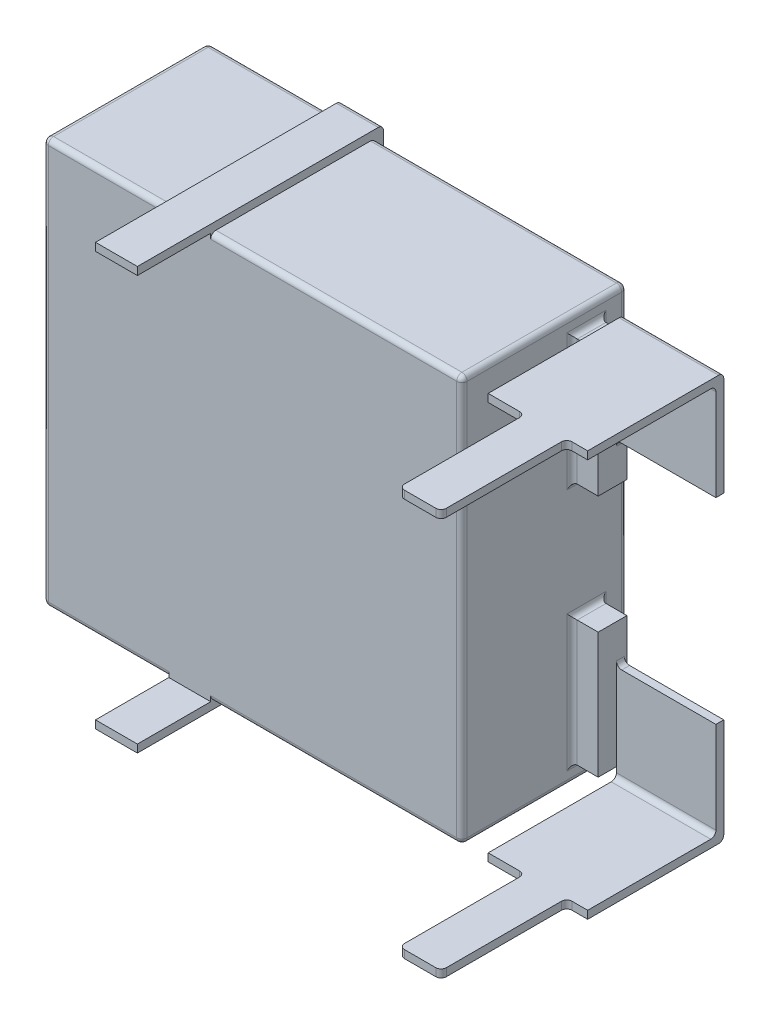
from build123d import *

# Parameters (mm, degrees)
SKETCH1_W           = 16
SKETCH1_H           = 15.5
BOSS_EXTRUDE1_DEPTH = 3.15
SKETCH2_W           = 4.839568974
SKETCH2_H           = 7
CUT_EXTRUDE1_DEPTH  = 10
SKETCH4_W           = 1.09636118
SKETCH4_H           = 4.8
BOSS_EXTRUDE3_DEPTH = 1
FILLET2_R           = 0.2
SKETCH5_W           = 0.3
SKETCH5_H           = 4
BOSS_EXTRUDE4_DEPTH = 3.8
SKETCH6_W           = 3.8
SKETCH6_H           = 0.3
BOSS_EXTRUDE5_DEPTH = 4.9
SKETCH7_W           = 1.6
SKETCH7_H           = 0.3
BOSS_EXTRUDE6_DEPTH = 4.8
FILLET3_R           = 0.2
SKETCH8_W           = 1.6
SKETCH8_H           = 16.1
BOSS_EXTRUDE7_DEPTH = 0.3
SKETCH9_W           = 1.6
SKETCH9_H           = 0.3
BOSS_EXTRUDE8_DEPTH = 9.1
FILLET5_R           = 0.2


with BuildPart() as part:
    # Sketch1 → Boss-Extrude1 (new, symmetric)
    with BuildSketch(Plane.XY):
        with Locations((-9.153020979, 0.149054717)):
            Rectangle(SKETCH1_W, SKETCH1_H)
    extrude(amount=BOSS_EXTRUDE1_DEPTH, both=True)

    # Sketch2 → Cut-Extrude1 (cut)
    with BuildSketch(Plane.ZY.offset(17.153020979)):
        with Locations((0, 4.099054717)):
            Rectangle(SKETCH2_W, SKETCH2_H)
        with Locations((0, -3.800945283)):
            Rectangle(SKETCH2_W, SKETCH2_H)
    extrude(amount=-CUT_EXTRUDE1_DEPTH, mode=Mode.SUBTRACT)

    # Sketch4 → Boss-Extrude3 (add)
    with BuildSketch(Plane(origin=(-1.153020979, 0, 0), x_dir=(0, 0, -1), z_dir=(1, 0, 0))):
        with Locations((1.60181941, 4.799054717)):
            Rectangle(SKETCH4_W, SKETCH4_H)
        with Locations((1.60181941, -4.500945283)):
            Rectangle(SKETCH4_W, SKETCH4_H)
    extrude(amount=BOSS_EXTRUDE3_DEPTH)

    # Fillet2
    fillet2_edges = [part.edges().sort_by_distance(p)[0] for p in [
        (-1.153020979, -2.100945283, -1.60181941),
        (-1.153020979, -4.500945283, -1.05363882),
        (-1.153020979, -6.900945283, -1.60181941),
        (-1.153020979, -4.500945283, -2.15),
        (-1.153020979, 7.199054717, -1.60181941),
        (-1.153020979, 4.799054717, -1.05363882),
        (-1.153020979, 2.399054717, -1.60181941),
        (-1.153020979, 4.799054717, -2.15),
    ]]
    fillet(fillet2_edges, radius=FILLET2_R)

    # Sketch5 → Boss-Extrude4 (add)
    with BuildSketch(Plane(origin=(-0.153020979, 0, 0), x_dir=(0, 0, -1), z_dir=(1, 0, 0))):
        with Locations((1.901438406, 5.899054717)):
            Rectangle(SKETCH5_W, SKETCH5_H)
        with Locations((1.901438406, -5.600945283)):
            Rectangle(SKETCH5_W, SKETCH5_H)
    extrude(amount=BOSS_EXTRUDE4_DEPTH)

    # Sketch6 → Boss-Extrude5 (add)
    with BuildSketch(Plane.XY.offset(-1.751438406)):
        with Locations((1.746979021, -7.450945283)):
            Rectangle(SKETCH6_W, SKETCH6_H)
        with Locations((1.746979021, 7.749054717)):
            Rectangle(SKETCH6_W, SKETCH6_H)
    extrude(amount=BOSS_EXTRUDE5_DEPTH)

    # Sketch7 → Boss-Extrude6 (add)
    with BuildSketch(Plane.XY.offset(3.148561594)):
        with Locations((2.046979021, 7.749054717)):
            Rectangle(SKETCH7_W, SKETCH7_H)
        with Locations((2.046979021, -7.450945283)):
            Rectangle(SKETCH7_W, SKETCH7_H)
    extrude(amount=BOSS_EXTRUDE6_DEPTH)

    # Fillet3
    fillet3_edges = [part.edges().sort_by_distance(p)[0] for p in [
        (-0.153020979, 3.899054717, -1.901438406),
        (1.746979021, 7.899054717, -2.051438406),
        (1.746979021, -7.300945283, -1.751438406),
        (1.746979021, 7.599054717, -1.751438406),
        (1.246979021, 7.749054717, 3.148561594),
        (2.846979021, 7.749054717, 3.148561594),
        (1.246979021, 7.749054717, 7.948561594),
        (2.846979021, 7.749054717, 7.948561594),
        (1.246979021, -7.450945283, 3.148561594),
        (2.846979021, -7.450945283, 3.148561594),
        (1.246979021, -7.450945283, 7.948561594),
        (2.846979021, -7.450945283, 7.948561594),
        (1.746979021, -7.600945283, -2.051438406),
        (-0.153020979, -3.600945283, -1.901438406),
    ]]
    fillet(fillet3_edges, radius=FILLET3_R)

    # Sketch8 → Boss-Extrude7 (add)
    with BuildSketch(Plane(origin=(0, 0, -3.15), x_dir=(-1, 0, 0), z_dir=(0, 0, -1))):
        with Locations((11.553020979, 0.149054717)):
            Rectangle(SKETCH8_W, SKETCH8_H)
    extrude(amount=BOSS_EXTRUDE7_DEPTH)

    # Sketch9 → Boss-Extrude8 (add)
    with BuildSketch(Plane.XY.offset(-3.15)):
        with Locations((-11.553020979, -7.750945283)):
            Rectangle(SKETCH9_W, SKETCH9_H)
        with Locations((-11.553020979, 8.049054717)):
            Rectangle(SKETCH9_W, SKETCH9_H)
    extrude(amount=BOSS_EXTRUDE8_DEPTH)

    # Fillet5
    # the kernel refuses this fillet: 0.2 mm, written as the material it takes off along each edge
    with BuildSketch(Plane(origin=(-16.953020979, 7.699054717, 2.95), x_dir=(0, 0, 1), z_dir=(0, 1, 0))) as fillet5_piece_1_section:
        Polygon((0, 0), (FILLET5_R * 1.02, 0), (FILLET5_R * 1.02, -FILLET5_R * 1.02), (0, -FILLET5_R * 1.02), align=None)
    fillet5_piece_1 = extrude(amount=FILLET5_R * 1.02, mode=Mode.PRIVATE)
    fillet5_piece_1 = fillet5_piece_1 - Plane(origin=(-16.953020979, 7.699054717, 2.95), x_dir=(0.7071067811865475, 0, -0.7071067811865475), z_dir=(0, 1, 0)) * Sphere(FILLET5_R, mode=Mode.PRIVATE)
    add(fillet5_piece_1, mode=Mode.SUBTRACT)
    with BuildSketch(Plane(origin=(-16.953020979, -7.400945283, 2.95), x_dir=(-1, 0, 0), z_dir=(0, 0, 1))) as fillet5_piece_2_section:
        Polygon((0, 0), (FILLET5_R * 1.02, 0), (FILLET5_R * 1.02, FILLET5_R * 1.02), (0, FILLET5_R * 1.02), align=None)
    fillet5_piece_2 = extrude(amount=FILLET5_R * 1.02, mode=Mode.PRIVATE)
    fillet5_piece_2 = fillet5_piece_2 - Plane(origin=(-16.953020979, -7.400945283, 2.95), x_dir=(0.7071067811865475, 0.7071067811865477, 0), z_dir=(0, 0, 1)) * Sphere(FILLET5_R, mode=Mode.PRIVATE)
    add(fillet5_piece_2, mode=Mode.SUBTRACT)
    with BuildSketch(Plane(origin=(-1.353020979, -7.400945283, -2.95), x_dir=(0, 0, -1), z_dir=(0, -1, 0))) as fillet5_piece_3_section:
        Polygon((0, 0), (FILLET5_R * 1.02, 0), (FILLET5_R * 1.02, FILLET5_R * 1.02), (0, FILLET5_R * 1.02), align=None)
    fillet5_piece_3 = extrude(amount=FILLET5_R * 1.02, mode=Mode.PRIVATE)
    fillet5_piece_3 = fillet5_piece_3 - Plane(origin=(-1.353020979, -7.400945283, -2.95), x_dir=(-0.7071067811865475, 0, 0.7071067811865475), z_dir=(0, -1, 0)) * Sphere(FILLET5_R, mode=Mode.PRIVATE)
    add(fillet5_piece_3, mode=Mode.SUBTRACT)
    with BuildSketch(Plane(origin=(-1.353020979, 7.699054717, -2.95), x_dir=(0, 0, -1), z_dir=(0, 1, 0))) as fillet5_piece_4_section:
        Polygon((0, 0), (FILLET5_R * 1.02, 0), (FILLET5_R * 1.02, -FILLET5_R * 1.02), (0, -FILLET5_R * 1.02), align=None)
    fillet5_piece_4 = extrude(amount=FILLET5_R * 1.02, mode=Mode.PRIVATE)
    fillet5_piece_4 = fillet5_piece_4 - Plane(origin=(-1.353020979, 7.699054717, -2.95), x_dir=(-0.7071067811865475, 0, 0.7071067811865475), z_dir=(0, 1, 0)) * Sphere(FILLET5_R, mode=Mode.PRIVATE)
    add(fillet5_piece_4, mode=Mode.SUBTRACT)
    with BuildSketch(Plane(origin=(-1.353020979, -7.400945283, 2.95), x_dir=(0, -1, 0), z_dir=(0, 0, 1))) as fillet5_piece_5_section:
        Polygon((0, 0), (FILLET5_R * 1.02, 0), (FILLET5_R * 1.02, FILLET5_R * 1.02), (0, FILLET5_R * 1.02), align=None)
    fillet5_piece_5 = extrude(amount=FILLET5_R * 1.02, mode=Mode.PRIVATE)
    fillet5_piece_5 = fillet5_piece_5 - Plane(origin=(-1.353020979, -7.400945283, 2.95), x_dir=(-0.7071067811865476, 0.7071067811865475, 0), z_dir=(0, 0, 1)) * Sphere(FILLET5_R, mode=Mode.PRIVATE)
    add(fillet5_piece_5, mode=Mode.SUBTRACT)
    with BuildSketch(Plane(origin=(-1.353020979, 7.699054717, 2.95), x_dir=(0, 1, 0), z_dir=(0, 0, 1))) as fillet5_piece_6_section:
        Polygon((0, 0), (FILLET5_R * 1.02, 0), (FILLET5_R * 1.02, -FILLET5_R * 1.02), (0, -FILLET5_R * 1.02), align=None)
    fillet5_piece_6 = extrude(amount=FILLET5_R * 1.02, mode=Mode.PRIVATE)
    fillet5_piece_6 = fillet5_piece_6 - Plane(origin=(-1.353020979, 7.699054717, 2.95), x_dir=(-0.7071067811865475, -0.7071067811865477, 0), z_dir=(0, 0, 1)) * Sphere(FILLET5_R, mode=Mode.PRIVATE)
    add(fillet5_piece_6, mode=Mode.SUBTRACT)
    with BuildSketch(Plane(origin=(-16.953020979, -7.400945283, -2.95), x_dir=(-1, 0, 0), z_dir=(0, -1, 0))) as fillet5_piece_7_section:
        Polygon((0, 0), (FILLET5_R * 1.02, 0), (FILLET5_R * 1.02, FILLET5_R * 1.02), (0, FILLET5_R * 1.02), align=None)
    fillet5_piece_7 = extrude(amount=FILLET5_R * 1.02, mode=Mode.PRIVATE)
    fillet5_piece_7 = fillet5_piece_7 - Plane(origin=(-16.953020979, -7.400945283, -2.95), x_dir=(0.7071067811865475, 0, 0.7071067811865475), z_dir=(0, -1, 0)) * Sphere(FILLET5_R, mode=Mode.PRIVATE)
    add(fillet5_piece_7, mode=Mode.SUBTRACT)
    with BuildSketch(Plane(origin=(-16.953020979, 7.699054717, -2.95), x_dir=(-1, 0, 0), z_dir=(0, 1, 0))) as fillet5_piece_8_section:
        Polygon((0, 0), (FILLET5_R * 1.02, 0), (FILLET5_R * 1.02, -FILLET5_R * 1.02), (0, -FILLET5_R * 1.02), align=None)
    fillet5_piece_8 = extrude(amount=FILLET5_R * 1.02, mode=Mode.PRIVATE)
    fillet5_piece_8 = fillet5_piece_8 - Plane(origin=(-16.953020979, 7.699054717, -2.95), x_dir=(0.7071067811865475, 0, 0.7071067811865475), z_dir=(0, 1, 0)) * Sphere(FILLET5_R, mode=Mode.PRIVATE)
    add(fillet5_piece_8, mode=Mode.SUBTRACT)
    with BuildSketch(Plane(origin=(-16.953020979, 7.899054717, 3.15), x_dir=(0, -1, 0), z_dir=(1, 0, 0))) as fillet5_piece_9_section:
        with BuildLine():
            CenterArc((FILLET5_R, FILLET5_R), FILLET5_R, 180, 90)
            Line((0, FILLET5_R), (-FILLET5_R * 0.02, FILLET5_R))
            Line((-FILLET5_R * 0.02, FILLET5_R), (-FILLET5_R * 0.02, -FILLET5_R * 0.02))
            Line((-FILLET5_R * 0.02, -FILLET5_R * 0.02), (FILLET5_R, -FILLET5_R * 0.02))
            Line((FILLET5_R, -FILLET5_R * 0.02), (FILLET5_R, 0))
        make_face()
    fillet5_piece_9 = extrude(amount=4.6, mode=Mode.PRIVATE)
    fillet5_piece_9 = split(fillet5_piece_9, bisect_by=Plane(origin=(-14.653020979, 7.899054717, 3.109305374), z_dir=(0, -1, 0)), keep=Keep.TOP, mode=Mode.PRIVATE)
    add(fillet5_piece_9, mode=Mode.SUBTRACT)
    with BuildSketch(Plane(origin=(-17.153020979, -7.400945283, 3.15), x_dir=(1, 0, 0), z_dir=(0, 1, 0)), Plane(origin=(-17.153020979, -7.400945283, -3.15), x_dir=(0, 0, 1), z_dir=(0, 1, 0)), Plane(origin=(-1.153020979, 7.699054717, -3.15), x_dir=(0, 0, 1), z_dir=(0, -1, 0))) as fillet5_piece_10:
        with BuildLine():
            CenterArc((FILLET5_R, FILLET5_R), FILLET5_R, 180, 90)
            Line((0, FILLET5_R), (-FILLET5_R * 0.02, FILLET5_R))
            Line((-FILLET5_R * 0.02, FILLET5_R), (-FILLET5_R * 0.02, -FILLET5_R * 0.02))
            Line((-FILLET5_R * 0.02, -FILLET5_R * 0.02), (FILLET5_R, -FILLET5_R * 0.02))
            Line((FILLET5_R, -FILLET5_R * 0.02), (FILLET5_R, 0))
        make_face()
    extrude(amount=15.1, mode=Mode.SUBTRACT)
    with BuildSketch(Plane(origin=(-17.153020979, 0.599054717, 2.419784487), x_dir=(0, 0, 1), z_dir=(0, 1, 0)), Plane(origin=(-17.153020979, 7.599054717, -2.419784487), x_dir=(0, 0, -1), z_dir=(0, -1, 0))) as fillet5_piece_11:
        with BuildLine():
            CenterArc((FILLET5_R, FILLET5_R), FILLET5_R, 180, 90)
            Line((0, FILLET5_R), (-FILLET5_R * 0.02, FILLET5_R))
            Line((-FILLET5_R * 0.02, FILLET5_R), (-FILLET5_R * 0.02, -FILLET5_R * 0.02))
            Line((-FILLET5_R * 0.02, -FILLET5_R * 0.02), (FILLET5_R, -FILLET5_R * 0.02))
            Line((FILLET5_R, -FILLET5_R * 0.02), (FILLET5_R, 0))
        make_face()
    extrude(amount=7, mode=Mode.SUBTRACT)
    with BuildSketch(Plane(origin=(-17.153020979, 7.599054717, 2.419784487), x_dir=(0, 1, 0), z_dir=(0, 0, -1)), Plane(origin=(-17.153020979, 0.599054717, -2.419784487), x_dir=(0, -1, 0), z_dir=(0, 0, 1))) as fillet5_piece_12:
        with BuildLine():
            CenterArc((FILLET5_R, FILLET5_R), FILLET5_R, 180, 90)
            Line((0, FILLET5_R), (-FILLET5_R * 0.02, FILLET5_R))
            Line((-FILLET5_R * 0.02, FILLET5_R), (-FILLET5_R * 0.02, -FILLET5_R * 0.02))
            Line((-FILLET5_R * 0.02, -FILLET5_R * 0.02), (FILLET5_R, -FILLET5_R * 0.02))
            Line((FILLET5_R, -FILLET5_R * 0.02), (FILLET5_R, 0))
        make_face()
    extrude(amount=4.839568974, mode=Mode.SUBTRACT)
    with BuildSketch(Plane(origin=(-17.153020979, -7.300945283, -2.419784487), x_dir=(0, 0, -1), z_dir=(0, 1, 0)), Plane(origin=(-17.153020979, -0.300945283, 2.419784487), x_dir=(0, 0, 1), z_dir=(0, -1, 0))) as fillet5_piece_13:
        with BuildLine():
            CenterArc((FILLET5_R, -FILLET5_R), FILLET5_R, 90, 90)
            Line((0, -FILLET5_R), (-FILLET5_R * 0.02, -FILLET5_R))
            Line((-FILLET5_R * 0.02, -FILLET5_R), (-FILLET5_R * 0.02, FILLET5_R * 0.02))
            Line((-FILLET5_R * 0.02, FILLET5_R * 0.02), (FILLET5_R, FILLET5_R * 0.02))
            Line((FILLET5_R, FILLET5_R * 0.02), (FILLET5_R, 0))
        make_face()
    extrude(amount=7, mode=Mode.SUBTRACT)
    with BuildSketch(Plane(origin=(-17.153020979, -7.300945283, 2.419784487), x_dir=(0, -1, 0), z_dir=(0, 0, -1)), Plane(origin=(-17.153020979, -0.300945283, -2.419784487), x_dir=(0, 1, 0), z_dir=(0, 0, 1))) as fillet5_piece_14:
        with BuildLine():
            CenterArc((FILLET5_R, -FILLET5_R), FILLET5_R, 90, 90)
            Line((0, -FILLET5_R), (-FILLET5_R * 0.02, -FILLET5_R))
            Line((-FILLET5_R * 0.02, -FILLET5_R), (-FILLET5_R * 0.02, FILLET5_R * 0.02))
            Line((-FILLET5_R * 0.02, FILLET5_R * 0.02), (FILLET5_R, FILLET5_R * 0.02))
            Line((FILLET5_R, FILLET5_R * 0.02), (FILLET5_R, 0))
        make_face()
    extrude(amount=4.839568974, mode=Mode.SUBTRACT)
    with BuildSketch(Plane(origin=(-1.353020979, -7.600945283, -3.15), x_dir=(0, 0, 1), z_dir=(-1, 0, 0)), Plane(origin=(-10.753020979, 7.899054717, -3.15), x_dir=(0, 0, 1), z_dir=(1, 0, 0))) as fillet5_piece_15:
        with BuildLine():
            CenterArc((FILLET5_R, FILLET5_R), FILLET5_R, 180, 90)
            Line((0, FILLET5_R), (-FILLET5_R * 0.02, FILLET5_R))
            Line((-FILLET5_R * 0.02, FILLET5_R), (-FILLET5_R * 0.02, -FILLET5_R * 0.02))
            Line((-FILLET5_R * 0.02, -FILLET5_R * 0.02), (FILLET5_R, -FILLET5_R * 0.02))
            Line((FILLET5_R, -FILLET5_R * 0.02), (FILLET5_R, 0))
        make_face()
    extrude(amount=9.4, mode=Mode.SUBTRACT)
    with BuildSketch(Plane(origin=(-10.753020979, 8.199054717, -3.45), x_dir=(0, 0, 1), z_dir=(-1, 0, 0))) as fillet5_piece_16:
        with BuildLine():
            CenterArc((FILLET5_R, -FILLET5_R), FILLET5_R, 90, 90)
            Line((0, -FILLET5_R), (-FILLET5_R * 0.02, -FILLET5_R))
            Line((-FILLET5_R * 0.02, -FILLET5_R), (-FILLET5_R * 0.02, FILLET5_R * 0.02))
            Line((-FILLET5_R * 0.02, FILLET5_R * 0.02), (FILLET5_R, FILLET5_R * 0.02))
            Line((FILLET5_R, FILLET5_R * 0.02), (FILLET5_R, 0))
        make_face()
    extrude(amount=1.6, mode=Mode.SUBTRACT)
    with BuildSketch(Plane(origin=(-12.353020979, -7.900945283, -3.45), x_dir=(0, 1, 0), z_dir=(1, 0, 0))) as fillet5_piece_17:
        with BuildLine():
            CenterArc((FILLET5_R, FILLET5_R), FILLET5_R, 180, 90)
            Line((0, FILLET5_R), (-FILLET5_R * 0.02, FILLET5_R))
            Line((-FILLET5_R * 0.02, FILLET5_R), (-FILLET5_R * 0.02, -FILLET5_R * 0.02))
            Line((-FILLET5_R * 0.02, -FILLET5_R * 0.02), (FILLET5_R, -FILLET5_R * 0.02))
            Line((FILLET5_R, -FILLET5_R * 0.02), (FILLET5_R, 0))
        make_face()
    extrude(amount=1.6, mode=Mode.SUBTRACT)
    with BuildSketch(Plane(origin=(-1.353020979, -7.600945283, 3.15), x_dir=(0, 1, 0), z_dir=(-1, 0, 0))) as fillet5_piece_18_section:
        with BuildLine():
            CenterArc((FILLET5_R, FILLET5_R), FILLET5_R, 180, 90)
            Line((0, FILLET5_R), (-FILLET5_R * 0.02, FILLET5_R))
            Line((-FILLET5_R * 0.02, FILLET5_R), (-FILLET5_R * 0.02, -FILLET5_R * 0.02))
            Line((-FILLET5_R * 0.02, -FILLET5_R * 0.02), (FILLET5_R, -FILLET5_R * 0.02))
            Line((FILLET5_R, -FILLET5_R * 0.02), (FILLET5_R, 0))
        make_face()
    fillet5_piece_18 = extrude(amount=9.4, mode=Mode.PRIVATE)
    fillet5_piece_18 = split(fillet5_piece_18, bisect_by=Plane(origin=(-6.053020979, -7.600945283, 3.109305374), z_dir=(0, 1, 0)), keep=Keep.TOP, mode=Mode.PRIVATE)
    add(fillet5_piece_18, mode=Mode.SUBTRACT)
    with BuildSketch(Plane(origin=(-10.753020979, 7.899054717, 3.15), x_dir=(0, -1, 0), z_dir=(1, 0, 0))) as fillet5_piece_19_section:
        with BuildLine():
            CenterArc((FILLET5_R, FILLET5_R), FILLET5_R, 180, 90)
            Line((0, FILLET5_R), (-FILLET5_R * 0.02, FILLET5_R))
            Line((-FILLET5_R * 0.02, FILLET5_R), (-FILLET5_R * 0.02, -FILLET5_R * 0.02))
            Line((-FILLET5_R * 0.02, -FILLET5_R * 0.02), (FILLET5_R, -FILLET5_R * 0.02))
            Line((FILLET5_R, -FILLET5_R * 0.02), (FILLET5_R, 0))
        make_face()
    fillet5_piece_19 = extrude(amount=9.4, mode=Mode.PRIVATE)
    fillet5_piece_19 = split(fillet5_piece_19, bisect_by=Plane(origin=(-6.053020979, 7.899054717, 3.109305374), z_dir=(0, -1, 0)), keep=Keep.TOP, mode=Mode.PRIVATE)
    add(fillet5_piece_19, mode=Mode.SUBTRACT)
    with BuildSketch(Plane(origin=(-12.353020979, -7.600945283, 3.15), x_dir=(0, 1, 0), z_dir=(-1, 0, 0))) as fillet5_piece_20_section:
        with BuildLine():
            CenterArc((FILLET5_R, FILLET5_R), FILLET5_R, 180, 90)
            Line((0, FILLET5_R), (-FILLET5_R * 0.02, FILLET5_R))
            Line((-FILLET5_R * 0.02, FILLET5_R), (-FILLET5_R * 0.02, -FILLET5_R * 0.02))
            Line((-FILLET5_R * 0.02, -FILLET5_R * 0.02), (FILLET5_R, -FILLET5_R * 0.02))
            Line((FILLET5_R, -FILLET5_R * 0.02), (FILLET5_R, 0))
        make_face()
    fillet5_piece_20 = extrude(amount=4.6, mode=Mode.PRIVATE)
    fillet5_piece_20 = split(fillet5_piece_20, bisect_by=Plane(origin=(-14.653020979, -7.600945283, 3.109305374), z_dir=(0, 1, 0)), keep=Keep.TOP, mode=Mode.PRIVATE)
    add(fillet5_piece_20, mode=Mode.SUBTRACT)
    with BuildSketch(Plane(origin=(-16.953020979, 7.899054717, -3.15), x_dir=(0, -1, 0), z_dir=(1, 0, 0)), Plane(origin=(-12.353020979, -7.600945283, -3.15), x_dir=(0, 1, 0), z_dir=(-1, 0, 0))) as fillet5_piece_21:
        with BuildLine():
            CenterArc((FILLET5_R, -FILLET5_R), FILLET5_R, 90, 90)
            Line((0, -FILLET5_R), (-FILLET5_R * 0.02, -FILLET5_R))
            Line((-FILLET5_R * 0.02, -FILLET5_R), (-FILLET5_R * 0.02, FILLET5_R * 0.02))
            Line((-FILLET5_R * 0.02, FILLET5_R * 0.02), (FILLET5_R, FILLET5_R * 0.02))
            Line((FILLET5_R, FILLET5_R * 0.02), (FILLET5_R, 0))
        make_face()
    extrude(amount=4.6, mode=Mode.SUBTRACT)
    with BuildSketch(Plane(origin=(-17.153020979, -7.600945283, -2.95), x_dir=(0, 1, 0), z_dir=(0, 0, 1)), Plane(origin=(-1.153020979, -7.600945283, 2.95), x_dir=(0, 1, 0), z_dir=(0, 0, -1))) as fillet5_piece_22:
        with BuildLine():
            CenterArc((FILLET5_R, -FILLET5_R), FILLET5_R, 90, 90)
            Line((0, -FILLET5_R), (-FILLET5_R * 0.02, -FILLET5_R))
            Line((-FILLET5_R * 0.02, -FILLET5_R), (-FILLET5_R * 0.02, FILLET5_R * 0.02))
            Line((-FILLET5_R * 0.02, FILLET5_R * 0.02), (FILLET5_R, FILLET5_R * 0.02))
            Line((FILLET5_R, FILLET5_R * 0.02), (FILLET5_R, 0))
        make_face()
    extrude(amount=5.9, mode=Mode.SUBTRACT)
    with BuildSketch(Plane(origin=(-17.153020979, 7.899054717, -2.95), x_dir=(0, -1, 0), z_dir=(0, 0, 1)), Plane(origin=(-1.153020979, 7.899054717, 2.95), x_dir=(0, -1, 0), z_dir=(0, 0, -1))) as fillet5_piece_23:
        with BuildLine():
            CenterArc((FILLET5_R, FILLET5_R), FILLET5_R, 180, 90)
            Line((0, FILLET5_R), (-FILLET5_R * 0.02, FILLET5_R))
            Line((-FILLET5_R * 0.02, FILLET5_R), (-FILLET5_R * 0.02, -FILLET5_R * 0.02))
            Line((-FILLET5_R * 0.02, -FILLET5_R * 0.02), (FILLET5_R, -FILLET5_R * 0.02))
            Line((FILLET5_R, -FILLET5_R * 0.02), (FILLET5_R, 0))
        make_face()
    extrude(amount=5.9, mode=Mode.SUBTRACT)
    with BuildSketch(Plane(origin=(-1.153020979, 7.699054717, 3.15), x_dir=(0, 0, -1), z_dir=(0, -1, 0))) as fillet5_piece_24:
        with BuildLine():
            CenterArc((FILLET5_R, -FILLET5_R), FILLET5_R, 90, 90)
            Line((0, -FILLET5_R), (-FILLET5_R * 0.02, -FILLET5_R))
            Line((-FILLET5_R * 0.02, -FILLET5_R), (-FILLET5_R * 0.02, FILLET5_R * 0.02))
            Line((-FILLET5_R * 0.02, FILLET5_R * 0.02), (FILLET5_R, FILLET5_R * 0.02))
            Line((FILLET5_R, FILLET5_R * 0.02), (FILLET5_R, 0))
        make_face()
    extrude(amount=15.1, mode=Mode.SUBTRACT)
    with BuildSketch(Plane(origin=(-17.153020979, 0.099054717, 2.419784487), x_dir=(0, 0, 1), z_dir=(0, 1, 0))) as fillet5_piece_25a_section:
        with BuildLine():
            CenterArc((FILLET5_R, FILLET5_R), FILLET5_R, 180, 90)
            Line((0, FILLET5_R), (-FILLET5_R * 0.02, FILLET5_R))
            Line((-FILLET5_R * 0.02, FILLET5_R), (-FILLET5_R * 0.02, -FILLET5_R * 0.02))
            Line((-FILLET5_R * 0.02, -FILLET5_R * 0.02), (FILLET5_R, -FILLET5_R * 0.02))
            Line((FILLET5_R, -FILLET5_R * 0.02), (FILLET5_R, 0))
        make_face()
    fillet5_piece_25a = extrude(amount=7.5, mode=Mode.PRIVATE)
    fillet5_piece_25a = split(fillet5_piece_25a, bisect_by=Plane(origin=(-17.107741957, 0.599054717, 2.46506351), z_dir=(0, -1, 0)), keep=Keep.TOP, mode=Mode.PRIVATE)
    with BuildSketch(Plane(origin=(-17.153020979, 0.599054717, -2.419784487), x_dir=(0, -1, 0), z_dir=(0, 0, 1))) as fillet5_piece_25b_section:
        with BuildLine():
            CenterArc((FILLET5_R, FILLET5_R), FILLET5_R, 180, 90)
            Line((0, FILLET5_R), (-FILLET5_R * 0.02, FILLET5_R))
            Line((-FILLET5_R * 0.02, FILLET5_R), (-FILLET5_R * 0.02, -FILLET5_R * 0.02))
            Line((-FILLET5_R * 0.02, -FILLET5_R * 0.02), (FILLET5_R, -FILLET5_R * 0.02))
            Line((FILLET5_R, -FILLET5_R * 0.02), (FILLET5_R, 0))
        make_face()
    fillet5_piece_25b = extrude(amount=5.339568974, mode=Mode.PRIVATE)
    fillet5_piece_25b = split(fillet5_piece_25b, bisect_by=Plane(origin=(-17.107741957, 0.553775695, 2.419784487), z_dir=(0, 0, 1)), keep=Keep.TOP, mode=Mode.PRIVATE)
    fillet5_piece_25 = fillet5_piece_25a & fillet5_piece_25b
    add(fillet5_piece_25, mode=Mode.SUBTRACT)
    with BuildSketch(Plane(origin=(-17.153020979, 7.599054717, 2.919784487), x_dir=(0, 1, 0), z_dir=(0, 0, -1))) as fillet5_piece_26a_section:
        with BuildLine():
            CenterArc((FILLET5_R, FILLET5_R), FILLET5_R, 180, 90)
            Line((0, FILLET5_R), (-FILLET5_R * 0.02, FILLET5_R))
            Line((-FILLET5_R * 0.02, FILLET5_R), (-FILLET5_R * 0.02, -FILLET5_R * 0.02))
            Line((-FILLET5_R * 0.02, -FILLET5_R * 0.02), (FILLET5_R, -FILLET5_R * 0.02))
            Line((FILLET5_R, -FILLET5_R * 0.02), (FILLET5_R, 0))
        make_face()
    fillet5_piece_26a = extrude(amount=5.339568974, mode=Mode.PRIVATE)
    fillet5_piece_26a = split(fillet5_piece_26a, bisect_by=Plane(origin=(-17.107741957, 7.64433374, 2.419784487), z_dir=(0, 0, 1)), keep=Keep.TOP, mode=Mode.PRIVATE)
    with BuildSketch(Plane(origin=(-17.153020979, 0.599054717, 2.419784487), x_dir=(0, 0, 1), z_dir=(0, 1, 0))) as fillet5_piece_26b_section:
        with BuildLine():
            CenterArc((FILLET5_R, FILLET5_R), FILLET5_R, 180, 90)
            Line((0, FILLET5_R), (-FILLET5_R * 0.02, FILLET5_R))
            Line((-FILLET5_R * 0.02, FILLET5_R), (-FILLET5_R * 0.02, -FILLET5_R * 0.02))
            Line((-FILLET5_R * 0.02, -FILLET5_R * 0.02), (FILLET5_R, -FILLET5_R * 0.02))
            Line((FILLET5_R, -FILLET5_R * 0.02), (FILLET5_R, 0))
        make_face()
    fillet5_piece_26b = extrude(amount=7.5, mode=Mode.PRIVATE)
    fillet5_piece_26b = split(fillet5_piece_26b, bisect_by=Plane(origin=(-17.107741957, 7.599054717, 2.46506351), z_dir=(0, 1, 0)), keep=Keep.TOP, mode=Mode.PRIVATE)
    fillet5_piece_26 = fillet5_piece_26a & fillet5_piece_26b
    add(fillet5_piece_26, mode=Mode.SUBTRACT)
    with BuildSketch(Plane(origin=(-17.153020979, 8.099054717, -2.419784487), x_dir=(0, 0, -1), z_dir=(0, -1, 0))) as fillet5_piece_27a_section:
        with BuildLine():
            CenterArc((FILLET5_R, FILLET5_R), FILLET5_R, 180, 90)
            Line((0, FILLET5_R), (-FILLET5_R * 0.02, FILLET5_R))
            Line((-FILLET5_R * 0.02, FILLET5_R), (-FILLET5_R * 0.02, -FILLET5_R * 0.02))
            Line((-FILLET5_R * 0.02, -FILLET5_R * 0.02), (FILLET5_R, -FILLET5_R * 0.02))
            Line((FILLET5_R, -FILLET5_R * 0.02), (FILLET5_R, 0))
        make_face()
    fillet5_piece_27a = extrude(amount=7.5, mode=Mode.PRIVATE)
    fillet5_piece_27a = split(fillet5_piece_27a, bisect_by=Plane(origin=(-17.107741957, 7.599054717, -2.46506351), z_dir=(0, 1, 0)), keep=Keep.TOP, mode=Mode.PRIVATE)
    with BuildSketch(Plane(origin=(-17.153020979, 7.599054717, 2.419784487), x_dir=(0, 1, 0), z_dir=(0, 0, -1))) as fillet5_piece_27b_section:
        with BuildLine():
            CenterArc((FILLET5_R, FILLET5_R), FILLET5_R, 180, 90)
            Line((0, FILLET5_R), (-FILLET5_R * 0.02, FILLET5_R))
            Line((-FILLET5_R * 0.02, FILLET5_R), (-FILLET5_R * 0.02, -FILLET5_R * 0.02))
            Line((-FILLET5_R * 0.02, -FILLET5_R * 0.02), (FILLET5_R, -FILLET5_R * 0.02))
            Line((FILLET5_R, -FILLET5_R * 0.02), (FILLET5_R, 0))
        make_face()
    fillet5_piece_27b = extrude(amount=5.339568974, mode=Mode.PRIVATE)
    fillet5_piece_27b = split(fillet5_piece_27b, bisect_by=Plane(origin=(-17.107741957, 7.64433374, -2.419784487), z_dir=(0, 0, -1)), keep=Keep.TOP, mode=Mode.PRIVATE)
    fillet5_piece_27 = fillet5_piece_27a & fillet5_piece_27b
    add(fillet5_piece_27, mode=Mode.SUBTRACT)
    with BuildSketch(Plane(origin=(-17.153020979, 7.599054717, -2.419784487), x_dir=(0, 0, -1), z_dir=(0, -1, 0))) as fillet5_piece_28a_section:
        with BuildLine():
            CenterArc((FILLET5_R, FILLET5_R), FILLET5_R, 180, 90)
            Line((0, FILLET5_R), (-FILLET5_R * 0.02, FILLET5_R))
            Line((-FILLET5_R * 0.02, FILLET5_R), (-FILLET5_R * 0.02, -FILLET5_R * 0.02))
            Line((-FILLET5_R * 0.02, -FILLET5_R * 0.02), (FILLET5_R, -FILLET5_R * 0.02))
            Line((FILLET5_R, -FILLET5_R * 0.02), (FILLET5_R, 0))
        make_face()
    fillet5_piece_28a = extrude(amount=7.5, mode=Mode.PRIVATE)
    fillet5_piece_28a = split(fillet5_piece_28a, bisect_by=Plane(origin=(-17.107741957, 0.599054717, -2.46506351), z_dir=(0, -1, 0)), keep=Keep.TOP, mode=Mode.PRIVATE)
    with BuildSketch(Plane(origin=(-17.153020979, 0.599054717, -2.919784487), x_dir=(0, -1, 0), z_dir=(0, 0, 1))) as fillet5_piece_28b_section:
        with BuildLine():
            CenterArc((FILLET5_R, FILLET5_R), FILLET5_R, 180, 90)
            Line((0, FILLET5_R), (-FILLET5_R * 0.02, FILLET5_R))
            Line((-FILLET5_R * 0.02, FILLET5_R), (-FILLET5_R * 0.02, -FILLET5_R * 0.02))
            Line((-FILLET5_R * 0.02, -FILLET5_R * 0.02), (FILLET5_R, -FILLET5_R * 0.02))
            Line((FILLET5_R, -FILLET5_R * 0.02), (FILLET5_R, 0))
        make_face()
    fillet5_piece_28b = extrude(amount=5.339568974, mode=Mode.PRIVATE)
    fillet5_piece_28b = split(fillet5_piece_28b, bisect_by=Plane(origin=(-17.107741957, 0.553775695, -2.419784487), z_dir=(0, 0, -1)), keep=Keep.TOP, mode=Mode.PRIVATE)
    fillet5_piece_28 = fillet5_piece_28a & fillet5_piece_28b
    add(fillet5_piece_28, mode=Mode.SUBTRACT)
    with BuildSketch(Plane(origin=(-17.153020979, -7.300945283, 2.419784487), x_dir=(0, -1, 0), z_dir=(0, 0, -1))) as fillet5_piece_29a_section:
        with BuildLine():
            CenterArc((FILLET5_R, -FILLET5_R), FILLET5_R, 90, 90)
            Line((0, -FILLET5_R), (-FILLET5_R * 0.02, -FILLET5_R))
            Line((-FILLET5_R * 0.02, -FILLET5_R), (-FILLET5_R * 0.02, FILLET5_R * 0.02))
            Line((-FILLET5_R * 0.02, FILLET5_R * 0.02), (FILLET5_R, FILLET5_R * 0.02))
            Line((FILLET5_R, FILLET5_R * 0.02), (FILLET5_R, 0))
        make_face()
    fillet5_piece_29a = extrude(amount=5.339568974, mode=Mode.PRIVATE)
    fillet5_piece_29a = split(fillet5_piece_29a, bisect_by=Plane(origin=(-17.107741957, -7.346224305, -2.419784487), z_dir=(0, 0, -1)), keep=Keep.TOP, mode=Mode.PRIVATE)
    with BuildSketch(Plane(origin=(-17.153020979, -7.800945283, -2.419784487), x_dir=(0, 0, -1), z_dir=(0, 1, 0))) as fillet5_piece_29b_section:
        with BuildLine():
            CenterArc((FILLET5_R, -FILLET5_R), FILLET5_R, 90, 90)
            Line((0, -FILLET5_R), (-FILLET5_R * 0.02, -FILLET5_R))
            Line((-FILLET5_R * 0.02, -FILLET5_R), (-FILLET5_R * 0.02, FILLET5_R * 0.02))
            Line((-FILLET5_R * 0.02, FILLET5_R * 0.02), (FILLET5_R, FILLET5_R * 0.02))
            Line((FILLET5_R, FILLET5_R * 0.02), (FILLET5_R, 0))
        make_face()
    fillet5_piece_29b = extrude(amount=7.5, mode=Mode.PRIVATE)
    fillet5_piece_29b = split(fillet5_piece_29b, bisect_by=Plane(origin=(-17.107741957, -7.300945283, -2.46506351), z_dir=(0, -1, 0)), keep=Keep.TOP, mode=Mode.PRIVATE)
    fillet5_piece_29 = fillet5_piece_29a & fillet5_piece_29b
    add(fillet5_piece_29, mode=Mode.SUBTRACT)
    with BuildSketch(Plane(origin=(-17.153020979, -7.300945283, -2.419784487), x_dir=(0, 0, -1), z_dir=(0, 1, 0))) as fillet5_piece_30a_section:
        with BuildLine():
            CenterArc((FILLET5_R, -FILLET5_R), FILLET5_R, 90, 90)
            Line((0, -FILLET5_R), (-FILLET5_R * 0.02, -FILLET5_R))
            Line((-FILLET5_R * 0.02, -FILLET5_R), (-FILLET5_R * 0.02, FILLET5_R * 0.02))
            Line((-FILLET5_R * 0.02, FILLET5_R * 0.02), (FILLET5_R, FILLET5_R * 0.02))
            Line((FILLET5_R, FILLET5_R * 0.02), (FILLET5_R, 0))
        make_face()
    fillet5_piece_30a = extrude(amount=7.5, mode=Mode.PRIVATE)
    fillet5_piece_30a = split(fillet5_piece_30a, bisect_by=Plane(origin=(-17.107741957, -0.300945283, -2.46506351), z_dir=(0, 1, 0)), keep=Keep.TOP, mode=Mode.PRIVATE)
    with BuildSketch(Plane(origin=(-17.153020979, -0.300945283, -2.919784487), x_dir=(0, 1, 0), z_dir=(0, 0, 1))) as fillet5_piece_30b_section:
        with BuildLine():
            CenterArc((FILLET5_R, -FILLET5_R), FILLET5_R, 90, 90)
            Line((0, -FILLET5_R), (-FILLET5_R * 0.02, -FILLET5_R))
            Line((-FILLET5_R * 0.02, -FILLET5_R), (-FILLET5_R * 0.02, FILLET5_R * 0.02))
            Line((-FILLET5_R * 0.02, FILLET5_R * 0.02), (FILLET5_R, FILLET5_R * 0.02))
            Line((FILLET5_R, FILLET5_R * 0.02), (FILLET5_R, 0))
        make_face()
    fillet5_piece_30b = extrude(amount=5.339568974, mode=Mode.PRIVATE)
    fillet5_piece_30b = split(fillet5_piece_30b, bisect_by=Plane(origin=(-17.107741957, -0.25566626, -2.419784487), z_dir=(0, 0, -1)), keep=Keep.TOP, mode=Mode.PRIVATE)
    fillet5_piece_30 = fillet5_piece_30a & fillet5_piece_30b
    add(fillet5_piece_30, mode=Mode.SUBTRACT)
    with BuildSketch(Plane(origin=(-17.153020979, -7.300945283, 2.919784487), x_dir=(0, -1, 0), z_dir=(0, 0, -1))) as fillet5_piece_31a_section:
        with BuildLine():
            CenterArc((FILLET5_R, -FILLET5_R), FILLET5_R, 90, 90)
            Line((0, -FILLET5_R), (-FILLET5_R * 0.02, -FILLET5_R))
            Line((-FILLET5_R * 0.02, -FILLET5_R), (-FILLET5_R * 0.02, FILLET5_R * 0.02))
            Line((-FILLET5_R * 0.02, FILLET5_R * 0.02), (FILLET5_R, FILLET5_R * 0.02))
            Line((FILLET5_R, FILLET5_R * 0.02), (FILLET5_R, 0))
        make_face()
    fillet5_piece_31a = extrude(amount=5.339568974, mode=Mode.PRIVATE)
    fillet5_piece_31a = split(fillet5_piece_31a, bisect_by=Plane(origin=(-17.107741957, -7.346224305, 2.419784487), z_dir=(0, 0, 1)), keep=Keep.TOP, mode=Mode.PRIVATE)
    with BuildSketch(Plane(origin=(-17.153020979, -0.300945283, 2.419784487), x_dir=(0, 0, 1), z_dir=(0, -1, 0))) as fillet5_piece_31b_section:
        with BuildLine():
            CenterArc((FILLET5_R, -FILLET5_R), FILLET5_R, 90, 90)
            Line((0, -FILLET5_R), (-FILLET5_R * 0.02, -FILLET5_R))
            Line((-FILLET5_R * 0.02, -FILLET5_R), (-FILLET5_R * 0.02, FILLET5_R * 0.02))
            Line((-FILLET5_R * 0.02, FILLET5_R * 0.02), (FILLET5_R, FILLET5_R * 0.02))
            Line((FILLET5_R, FILLET5_R * 0.02), (FILLET5_R, 0))
        make_face()
    fillet5_piece_31b = extrude(amount=7.5, mode=Mode.PRIVATE)
    fillet5_piece_31b = split(fillet5_piece_31b, bisect_by=Plane(origin=(-17.107741957, -7.300945283, 2.46506351), z_dir=(0, -1, 0)), keep=Keep.TOP, mode=Mode.PRIVATE)
    fillet5_piece_31 = fillet5_piece_31a & fillet5_piece_31b
    add(fillet5_piece_31, mode=Mode.SUBTRACT)
    with BuildSketch(Plane(origin=(-17.153020979, -0.300945283, -2.419784487), x_dir=(0, 1, 0), z_dir=(0, 0, 1))) as fillet5_piece_32a_section:
        with BuildLine():
            CenterArc((FILLET5_R, -FILLET5_R), FILLET5_R, 90, 90)
            Line((0, -FILLET5_R), (-FILLET5_R * 0.02, -FILLET5_R))
            Line((-FILLET5_R * 0.02, -FILLET5_R), (-FILLET5_R * 0.02, FILLET5_R * 0.02))
            Line((-FILLET5_R * 0.02, FILLET5_R * 0.02), (FILLET5_R, FILLET5_R * 0.02))
            Line((FILLET5_R, FILLET5_R * 0.02), (FILLET5_R, 0))
        make_face()
    fillet5_piece_32a = extrude(amount=5.339568974, mode=Mode.PRIVATE)
    fillet5_piece_32a = split(fillet5_piece_32a, bisect_by=Plane(origin=(-17.107741957, -0.25566626, 2.419784487), z_dir=(0, 0, 1)), keep=Keep.TOP, mode=Mode.PRIVATE)
    with BuildSketch(Plane(origin=(-17.153020979, 0.199054717, 2.419784487), x_dir=(0, 0, 1), z_dir=(0, -1, 0))) as fillet5_piece_32b_section:
        with BuildLine():
            CenterArc((FILLET5_R, -FILLET5_R), FILLET5_R, 90, 90)
            Line((0, -FILLET5_R), (-FILLET5_R * 0.02, -FILLET5_R))
            Line((-FILLET5_R * 0.02, -FILLET5_R), (-FILLET5_R * 0.02, FILLET5_R * 0.02))
            Line((-FILLET5_R * 0.02, FILLET5_R * 0.02), (FILLET5_R, FILLET5_R * 0.02))
            Line((FILLET5_R, FILLET5_R * 0.02), (FILLET5_R, 0))
        make_face()
    fillet5_piece_32b = extrude(amount=7.5, mode=Mode.PRIVATE)
    fillet5_piece_32b = split(fillet5_piece_32b, bisect_by=Plane(origin=(-17.107741957, -0.300945283, 2.46506351), z_dir=(0, 1, 0)), keep=Keep.TOP, mode=Mode.PRIVATE)
    fillet5_piece_32 = fillet5_piece_32a & fillet5_piece_32b
    add(fillet5_piece_32, mode=Mode.SUBTRACT)


solid = part.part
